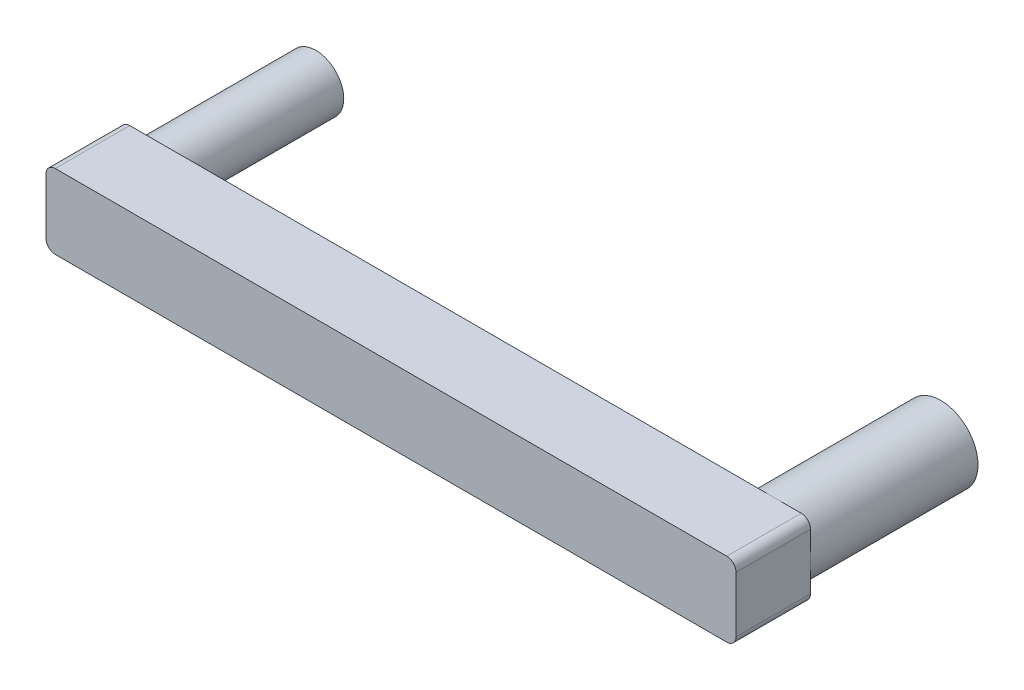
from build123d import *

# Parameters (mm, degrees)
SKETCH1_W           = 37.08
SKETCH1_H           = 4
BOSS_EXTRUDE1_DEPTH = 4
SKETCH1_3_R         = 1.5
SKETCH1_3_R_2       = 2
BOSS_EXTRUDE2_DEPTH = 9
FILLET1_R           = 0.5


with BuildPart() as part:
    # Sketch1 → Boss-Extrude1 (new body)
    with BuildSketch(Plane.XY):
        with Locations((18.54, -2)):
            Rectangle(SKETCH1_W, SKETCH1_H)
    extrude(amount=BOSS_EXTRUDE1_DEPTH)

    # Sketch1<3> → Boss-Extrude2 (add)
    with BuildSketch(Plane.XY):
        with Locations((1.5, -2)):
            Circle(SKETCH1_3_R)
        with Locations((35.08, -2)):
            Circle(SKETCH1_3_R_2)
    extrude(amount=-BOSS_EXTRUDE2_DEPTH)

    # Fillet1
    fillet1_edges = [part.edges().sort_by_distance(p)[0] for p in [
        (0, -4, 2),
        (0, 0, 2),
        (37.08, 0, 2),
        (37.08, -4, 2),
    ]]
    fillet(fillet1_edges, radius=FILLET1_R)


solid = part.part
